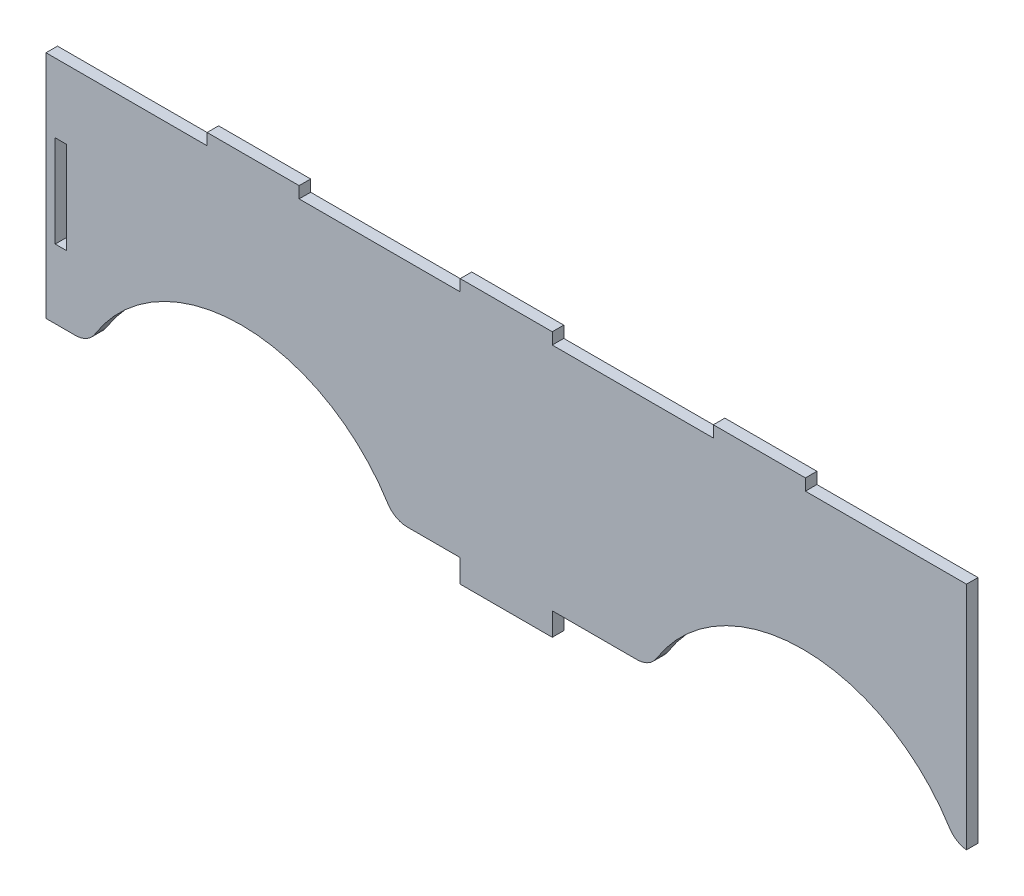
from build123d import *

# Parameters (mm, degrees)
SKETCH1_W           = 2.5
SKETCH1_H           = 20
BOSS_EXTRUDE1_DEPTH = 1.25
FILLET2_R           = 5


with BuildPart() as part:
    # Sketch1 → Boss-Extrude1 (new, symmetric)
    with BuildSketch(Plane.XY):
        with BuildLine():
            Line((-100, -25), (-100, 25))
            Line((-100, 25), (-65, 25))
            Line((-65, 25), (-65, 27.5))
            Line((-65, 27.5), (-45, 27.5))
            Line((-45, 27.5), (-45, 25))
            Line((-45, 25), (-10, 25))
            Line((-10, 25), (-10, 27.5))
            Line((-10, 27.5), (10, 27.5))
            Line((10, 27.5), (10, 25))
            Line((10, 25), (45, 25))
            Line((45, 25), (45, 27.5))
            Line((45, 27.5), (65, 27.5))
            Line((65, 27.5), (65, 25))
            Line((65, 25), (100, 25))
            Line((100, 25), (100, -25))
            Line((100, -25), (97.62, -25))
            ThreePointArc((97.62, -25), (64.453752096, -5), (31.287504193, -25))
            Line((31.287504193, -25), (10, -25))
            Line((10, -25), (10, -30))
            Line((10, -30), (-10, -30))
            Line((-10, -30), (-10, -25))
            Line((-10, -25), (-24.407504193, -25))
            ThreePointArc((-24.407504193, -25), (-57.573752096, -5), (-90.74, -25))
            Line((-90.74, -25), (-100, -25))
        make_face()
        with Locations((-96.75, 0)):
            Rectangle(SKETCH1_W, SKETCH1_H, mode=Mode.SUBTRACT)
    extrude(amount=BOSS_EXTRUDE1_DEPTH, both=True)

    # Fillet2
    # the kernel refuses this fillet: 5 mm, written as the material it takes off along each edge
    with BuildSketch(Plane(origin=(97.62, -25, 7.962737252), x_dir=(-0.49803133074323064, 0.8671590359317758, 0), z_dir=(0, 0, -1))) as fillet2_piece_1:
        with BuildLine():
            CenterArc((2.864101227, 4.996794646), FILLET2_R, 215.915482701, 52.032817446)
            Line((-1.185314567, 2.063838506), (-1.266302883, 2.005179383))
            ThreePointArc((-1.266302883, 2.005179383), (-0.679373187, 0.98211612), (-0.086715904, -0.049803133))
            Line((-0.086715904, -0.049803133), (0.003580127, -0.099935893))
            ThreePointArc((0.003580127, -0.099935893), (1.34254745, -0.075959846), (2.681514774, -0.099935893))
            Line((2.681514774, -0.099935893), (2.685094901, 0))
        make_face()
    extrude(amount=15.925474504, mode=Mode.SUBTRACT)
    with BuildSketch(Plane(origin=(31.287504193, -25, 8.473162128), x_dir=(-1, 0, 0), z_dir=(0, 0, -1))) as fillet2_piece_2:
        with BuildLine():
            CenterArc((2.889264851, 5), FILLET2_R, 211.965718751, 58.034281249)
            Line((-1.352560179, 2.352941176), (-1.437396679, 2.3))
            ThreePointArc((-1.437396679, 2.3), (-0.741683603, 1.138874159), (-0.088443328, -0.046666667))
            Line((-0.088443328, -0.046666667), (0, -0.1))
            Line((0, -0.1), (2.889264851, -0.1))
            Line((2.889264851, -0.1), (2.889264851, 0))
        make_face()
    extrude(amount=16.946324255, mode=Mode.SUBTRACT)
    with BuildSketch(Plane(origin=(-24.407504193, -25, -8.473162128), x_dir=(-0.4983656192119462, 0.8669669599168663, 0), z_dir=(0, 0, 1)), Plane(origin=(-90.74, -25, 8.473162128), x_dir=(0.4983656192119447, 0.8669669599168673, 0), z_dir=(0, 0, -1))) as fillet2_piece_3:
        with BuildLine():
            CenterArc((2.894924533, -4.99672526), FILLET2_R, 92.073789733, 58.034281249)
            Line((-1.439910267, -2.504897164), (-1.526606963, -2.455060602))
            Line((-1.526606963, -2.455060602), (-0.086696696, 0.049836562))
            Line((-0.086696696, 0.049836562), (0.003618656, 0.099934505))
            ThreePointArc((0.003618656, 0.099934505), (1.356995875, 0.075439453), (2.710373094, 0.099934505))
            Line((2.710373094, 0.099934505), (2.71399175, 0))
        make_face()
    extrude(amount=16.946324255, mode=Mode.SUBTRACT)


solid = part.part
